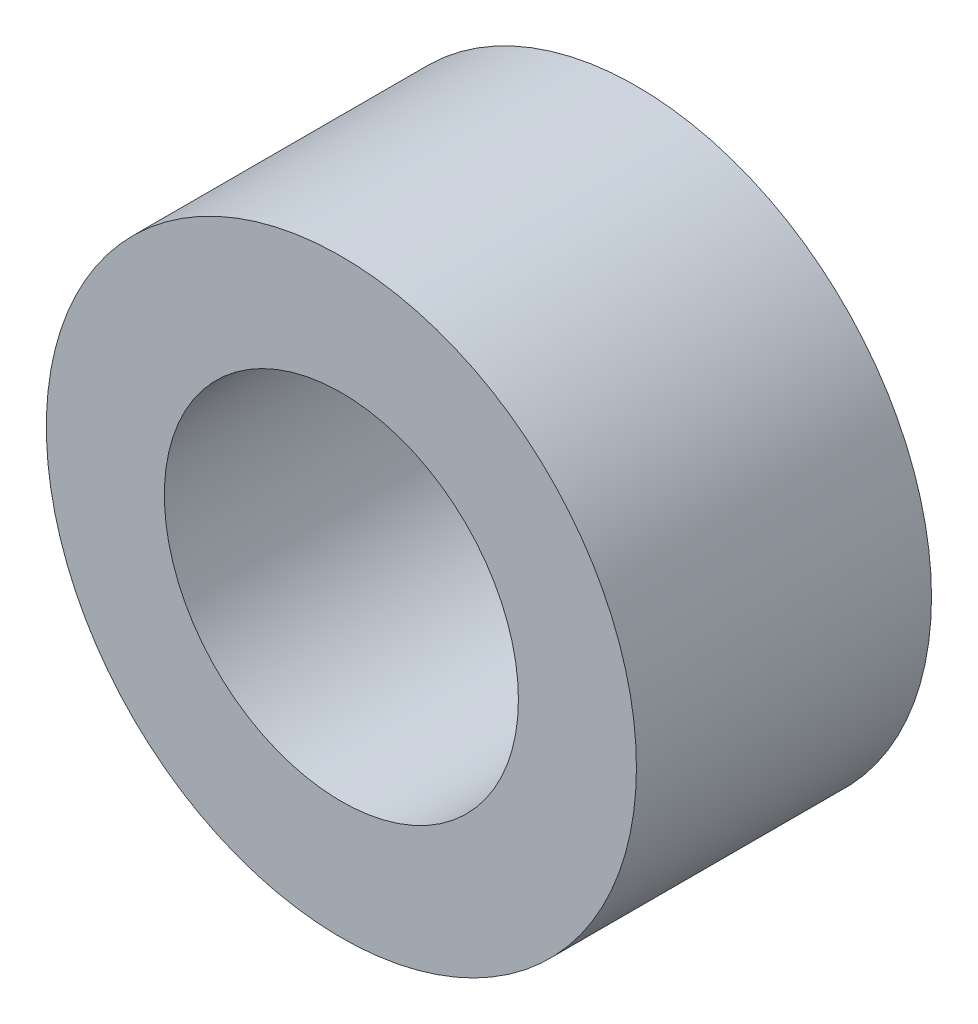
from build123d import *

# Parameters (mm, degrees)
SCHIZZO1_R                   = 25
SCHIZZO1_R_2                 = 15
ESTRUSIONE_ESTRUSIONE1_DEPTH = 25


with BuildPart() as part:
    # Schizzo1 → Estrusione-Estrusione1 (new body)
    with BuildSketch(Plane.XY):
        Circle(SCHIZZO1_R)
        Circle(SCHIZZO1_R_2, mode=Mode.SUBTRACT)
    extrude(amount=ESTRUSIONE_ESTRUSIONE1_DEPTH)


solid = part.part
